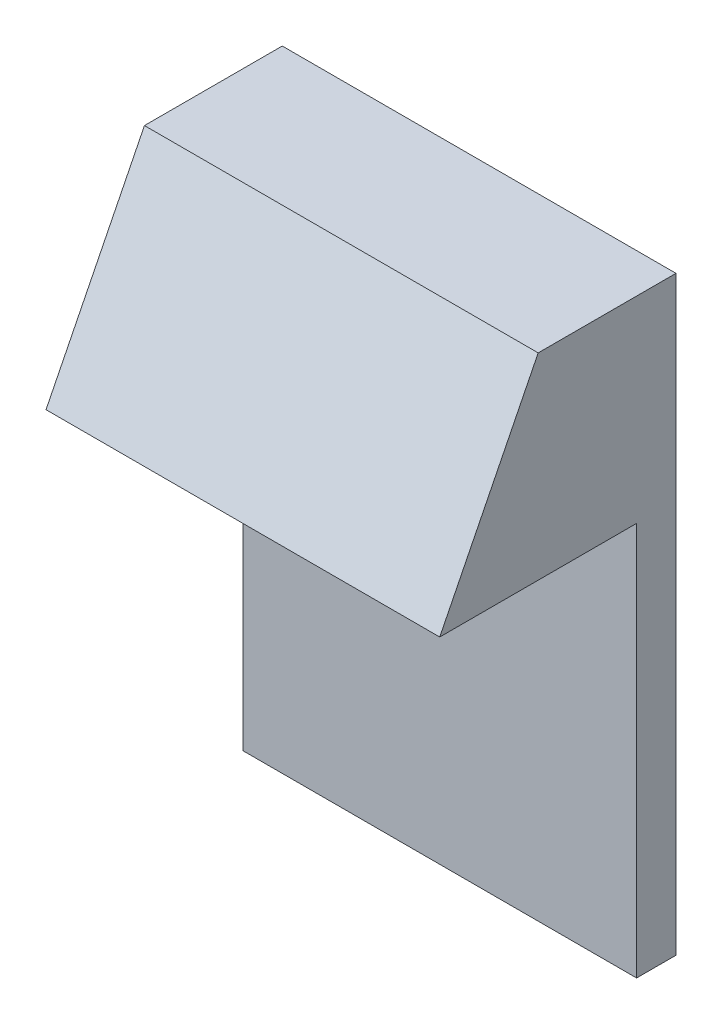
from build123d import *

# Parameters (mm, degrees)
SKETCH1_W           = 20
SKETCH1_H           = 30
BOSS_EXTRUDE1_DEPTH = 2
BOSS_EXTRUDE2_DEPTH = 20


with BuildPart() as part:
    # Sketch1 → Boss-Extrude1 (new body)
    with BuildSketch(Plane.XY):
        with Locations((10, 15)):
            Rectangle(SKETCH1_W, SKETCH1_H)
    extrude(amount=BOSS_EXTRUDE1_DEPTH)

    # Sketch3 → Boss-Extrude2 (add)
    with BuildSketch(Plane(origin=(20, 0, 0), x_dir=(0, 0, -1), z_dir=(1, 0, 0))):
        Polygon((-2, 20), (-12, 20), (-7, 30), (-2, 30), align=None)
    extrude(amount=-BOSS_EXTRUDE2_DEPTH)


solid = part.part
